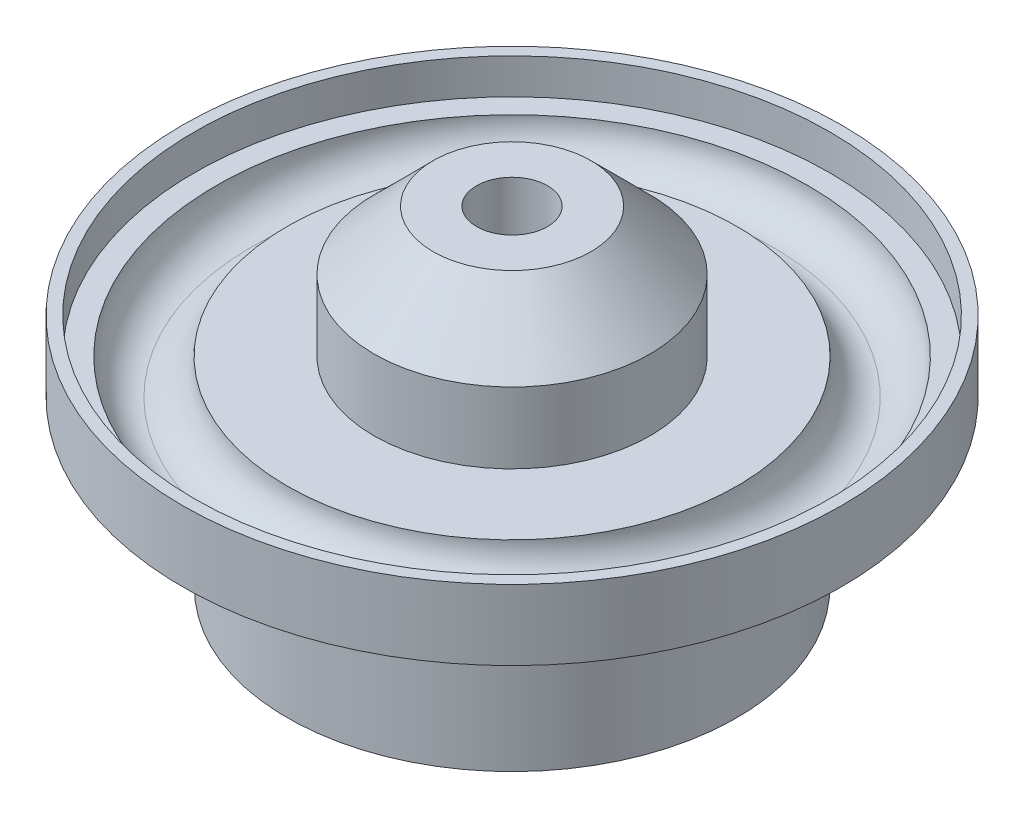
from build123d import *

# Parameters (mm, degrees)
SKETCH1_R           = 27.889608224
SKETCH1_R_2         = 3
BOSS_EXTRUDE1_DEPTH = 20
SKETCH2_R           = 26.889608224
CUT_EXTRUDE1_DEPTH  = 3
SKETCH2_5_R         = 25.031826588
SKETCH2_5_R_2       = 19.031826588
CUT_EXTRUDE2_DEPTH  = 6
FILLET1_R           = 3
SKETCH4_R           = 11.678118969
SKETCH4_R_2         = 3
BOSS_EXTRUDE2_DEPTH = 11
CHAMFER1_SIZE       = 5
SKETCH5_R           = 27.889608224
SKETCH5_R_2         = 19.009910513
CUT_EXTRUDE3_DEPTH  = 10
CHAMFER2_SIZE       = 6
CHAMFER2_SIZE2      = 4.047051101


with BuildPart() as part:
    # Sketch1 → Boss-Extrude1 (new body)
    with BuildSketch(Plane(origin=(0, 0, 0), x_dir=(1, 0, 0), z_dir=(0, 1, 0))):
        with Locations(Location((0, 0, 0), (0, 0, 270))):
            Circle(SKETCH1_R)
        with Locations(Location((0, 0, 0), (0, 0, 270))):
            Circle(SKETCH1_R_2, mode=Mode.SUBTRACT)
    extrude(amount=BOSS_EXTRUDE1_DEPTH)

    # Sketch2 → Cut-Extrude1 (cut)
    with BuildSketch(Plane(origin=(0, 20, 0), x_dir=(1, 0, 0), z_dir=(0, 1, 0))):
        with Locations(Location((0, 0, 0), (0, 0, 270))):
            Circle(SKETCH2_R)
    extrude(amount=-CUT_EXTRUDE1_DEPTH, mode=Mode.SUBTRACT)

    # Sketch2<5> → Cut-Extrude2 (cut)
    with BuildSketch(Plane(origin=(0, 20, 0), x_dir=(1, 0, 0), z_dir=(0, 1, 0))):
        with Locations(Location((0, 0, 0), (0, 0, 270))):
            Circle(SKETCH2_5_R)
        with Locations(Location((0, 0, 0), (0, 0, 270))):
            Circle(SKETCH2_5_R_2, mode=Mode.SUBTRACT)
    extrude(amount=-CUT_EXTRUDE2_DEPTH, mode=Mode.SUBTRACT)

    # Fillet1
    fillet1_edges = [part.edges().sort_by_distance(p)[0] for p in [
        (0, 14, -25.031826588),
        (0, 14, -19.031826588),
    ]]
    fillet(fillet1_edges, radius=FILLET1_R - 0.0001)  # a hair under: the kernel refuses the full size

    # Sketch4 → Boss-Extrude2 (add)
    with BuildSketch(Plane(origin=(0, 17, 0), x_dir=(1, 0, 0), z_dir=(0, 1, 0))):
        with Locations(Location((0, 0, 0), (0, 0, 270))):
            Circle(SKETCH4_R)
        with Locations(Location((0, 0, 0), (0, 0, 270))):
            Circle(SKETCH4_R_2, mode=Mode.SUBTRACT)
    extrude(amount=BOSS_EXTRUDE2_DEPTH)

    # Chamfer1
    chamfer1_edges = [part.edges().sort_by_distance(p)[0] for p in [
        (0, 28, -11.678118969),
    ]]
    chamfer(chamfer1_edges, length=CHAMFER1_SIZE)

    # Sketch5 → Cut-Extrude3 (cut)
    with BuildSketch(Plane.XZ):
        with Locations(Location((0, 0, 0), (0, 0, 270))):
            Circle(SKETCH5_R)
        with Locations(Location((0, 0, 0), (0, 0, 270))):
            Circle(SKETCH5_R_2, mode=Mode.SUBTRACT)
    extrude(amount=-CUT_EXTRUDE3_DEPTH, mode=Mode.SUBTRACT)

    # Chamfer2
    chamfer2_edges = [part.edges().sort_by_distance(p)[0] for p in [
        (0, 10, -27.889608224),
    ]]
    chamfer2_side = [part.faces().sort_by_distance(p)[0] for p in [
        (0, 10, -27.10077098),
    ]]
    chamfer(chamfer2_edges, length=CHAMFER2_SIZE, length2=CHAMFER2_SIZE2, reference=chamfer2_side[0])


solid = part.part
